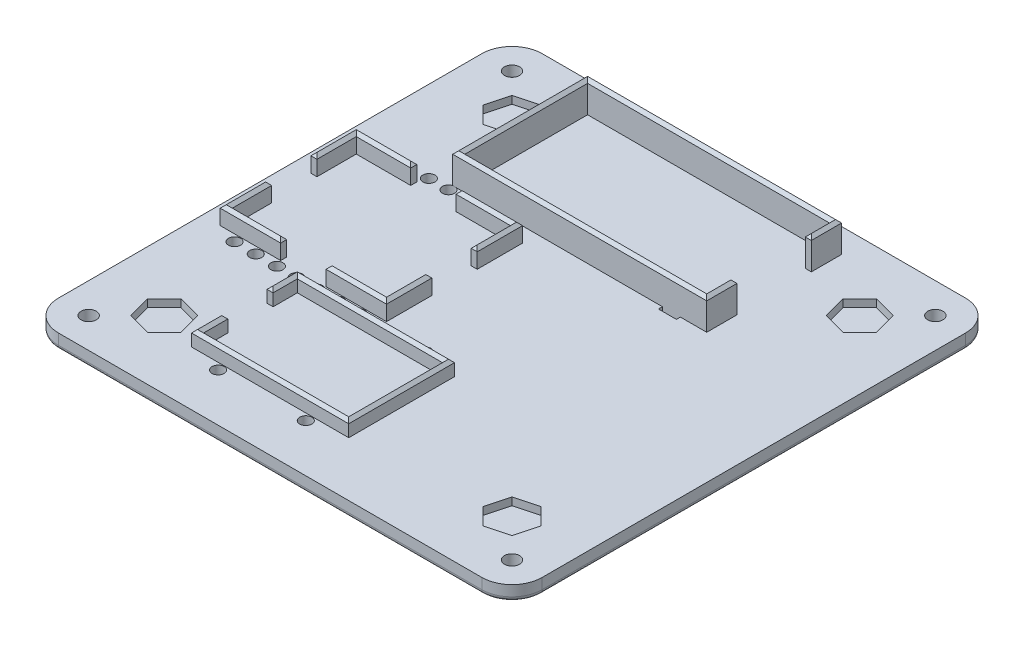
from build123d import *

# Parameters (mm, degrees)
SKETCH1_W           = 203.2
SKETCH1_H           = 203.2
BOSS_EXTRUDE1_DEPTH = 6.35
FILLET1_R           = 12.7
SKETCH2_R           = 3.175
CUT_EXTRUDE1_DEPTH  = 288.438345563
CUT_EXTRUDE2_DEPTH  = 3.175
BOSS_EXTRUDE2_DEPTH = 7.62
CHAMFER1_SIZE       = 1.27
BOSS_EXTRUDE3_DEPTH = 6.35
CHAMFER2_SIZE       = 1.27
SKETCH25_R          = 2.54
CUT_EXTRUDE3_DEPTH  = 6.35
BOSS_EXTRUDE4_DEPTH = 12.7
CHAMFER3_SIZE       = 1.27
SKETCH27_W          = 7.546250953
SKETCH27_H          = 2.549143633
SKETCH27_W_2        = 7.463160497
SKETCH27_H_2        = 1.676732019
CUT_EXTRUDE4_DEPTH  = 12.7
FILLET2_R           = 1.905


# Some blends are built 0.0001 mm under size
with BuildPart() as part:
    # Sketch1 → Boss-Extrude1 (new body)
    with BuildSketch(Plane(origin=(0, 0, 0), x_dir=(1, 0, 0), z_dir=(0, 1, 0))):
        with Locations((101.6, 101.6)):
            Rectangle(SKETCH1_W, SKETCH1_H)
    extrude(amount=BOSS_EXTRUDE1_DEPTH)

    # Fillet1
    fillet1_edges = [part.edges().sort_by_distance(p)[0] for p in [
        (0, 3.175, -203.2),
        (203.2, 3.175, -203.2),
        (203.2, 3.175, 0),
        (0, 3.175, 0),
    ]]
    fillet(fillet1_edges, radius=FILLET1_R)

    # Sketch2 → Cut-Extrude1 (cut, through all)
    with BuildSketch(Plane.XZ):
        with Locations(Location((12.7, -12.7, 0), (0, 0, 270))):
            Circle(SKETCH2_R)
        with Locations(Location((190.5, -12.7, 0), (0, 0, 270))):
            Circle(SKETCH2_R)
        with Locations(Location((190.5, -190.5, 0), (0, 0, 270))):
            Circle(SKETCH2_R)
        with Locations(Location((12.7, -190.5, 0), (0, 0, 270))):
            Circle(SKETCH2_R)
    extrude(amount=-CUT_EXTRUDE1_DEPTH, mode=Mode.SUBTRACT)

    # Sketch22 → Cut-Extrude2 (cut)
    with BuildSketch(Plane(origin=(0, 6.35, 0), x_dir=(1, 0, 0), z_dir=(0, 1, 0))):
        Polygon((181.654219065, 181.654219065), (172.052127253, 184.227091812), (165.022908188, 177.197872747), (167.595780935, 167.595780935), (177.197872747, 165.022908188), (184.227091812, 172.052127253), align=None)
        Polygon((18.972908188, 172.052127253), (21.545780935, 181.654219065), (31.147872747, 184.227091812), (38.177091812, 177.197872747), (35.604219065, 167.595780935), (26.002127253, 165.022908188), align=None)
        Polygon((184.227091812, 31.147872747), (181.654219065, 21.545780935), (172.052127253, 18.972908188), (165.022908188, 26.002127253), (167.595780935, 35.604219065), (177.197872747, 38.177091812), align=None)
        Polygon((21.545780935, 21.545780935), (31.147872747, 18.972908188), (38.177091812, 26.002127253), (35.604219065, 35.604219065), (26.002127253, 38.177091812), (18.972908188, 31.147872747), align=None)
    extrude(amount=-CUT_EXTRUDE2_DEPTH, mode=Mode.SUBTRACT)

    # Sketch23 → Boss-Extrude2 (add)
    with BuildSketch(Plane(origin=(0, 6.35, 0), x_dir=(1, 0, 0), z_dir=(0, 1, 0))):
        Polygon((77.47, 130.175), (52.07, 130.175), (52.07, 127.635), (74.93, 127.635), (74.93, 111.125), (77.47, 111.125), align=None)
        Polygon((77.47, 73.025), (52.07, 73.025), (52.07, 75.565), (74.93, 75.565), (74.93, 92.075), (77.47, 92.075), align=None)
        Polygon((7.62, 130.175), (7.62, 111.125), (10.16, 111.125), (10.16, 127.635), (33.02, 127.635), (33.02, 130.175), align=None)
        Polygon((10.16, 92.075), (7.62, 92.075), (7.62, 73.025), (33.02, 73.025), (33.02, 75.565), (10.16, 75.565), align=None)
    extrude(amount=BOSS_EXTRUDE2_DEPTH)

    # Chamfer1
    chamfer1_edges = [part.edges().sort_by_distance(p)[0] for p in [
        (77.47, 13.97, -120.65),
        (64.77, 13.97, -130.175),
        (52.07, 13.97, -128.905),
        (63.5, 13.97, -127.635),
        (74.93, 13.97, -119.38),
        (76.2, 13.97, -111.125),
        (7.62, 13.97, -82.55),
        (20.32, 13.97, -73.025),
        (33.02, 13.97, -74.295),
        (21.59, 13.97, -75.565),
        (10.16, 13.97, -83.82),
        (8.89, 13.97, -92.075),
        (77.47, 13.97, -82.55),
        (76.2, 13.97, -92.075),
        (74.93, 13.97, -83.82),
        (63.5, 13.97, -75.565),
        (52.07, 13.97, -74.295),
        (64.77, 13.97, -73.025),
        (20.32, 13.97, -130.175),
        (7.62, 13.97, -120.65),
        (8.89, 13.97, -111.125),
        (10.16, 13.97, -119.38),
        (21.59, 13.97, -127.635),
        (33.02, 13.97, -128.905),
    ]]
    chamfer(chamfer1_edges, length=CHAMFER1_SIZE - 0.0001)  # a hair under: the kernel refuses the full size

    # Sketch24 → Boss-Extrude3 (add)
    with BuildSketch(Plane(origin=(0, 6.35, 0), x_dir=(1, 0, 0), z_dir=(0, 1, 0))):
        Polygon((109.22, 64.77), (48.26, 64.77), (48.26, 54.61), (45.72, 54.61), (45.72, 67.31), (111.76, 67.31), (111.76, 22.86), (45.72, 22.86), (45.72, 35.56), (48.26, 35.56), (48.26, 25.4), (109.22, 25.4), align=None)
    extrude(amount=BOSS_EXTRUDE3_DEPTH)

    # Chamfer2
    chamfer2_edges = [part.edges().sort_by_distance(p)[0] for p in [
        (109.22, 12.7, -45.085),
        (78.74, 12.7, -25.4),
        (48.26, 12.7, -30.48),
        (46.99, 12.7, -35.56),
        (45.72, 12.7, -29.21),
        (78.74, 12.7, -22.86),
        (111.76, 12.7, -45.085),
        (78.74, 12.7, -67.31),
        (45.72, 12.7, -60.96),
        (46.99, 12.7, -54.61),
        (48.26, 12.7, -59.69),
        (78.74, 12.7, -64.77),
    ]]
    chamfer(chamfer2_edges, length=CHAMFER2_SIZE - 0.0001)  # a hair under: the kernel refuses the full size

    # Sketch25 → Cut-Extrude3 (cut)
    with BuildSketch(Plane(origin=(0, 6.35, 0), x_dir=(1, 0, 0), z_dir=(0, 1, 0))):
        with Locations(Location((68.58, 70.1675, 0), (0, 0, 270))):
            Circle(SKETCH25_R)
        with Locations(Location((59.69, 70.1675, 0), (0, 0, 270))):
            Circle(SKETCH25_R)
        with Locations(Location((50.8, 70.1675, 0), (0, 0, 270))):
            Circle(SKETCH25_R)
        with Locations(Location((42.545, 70.1675, 0), (0, 0, 270))):
            Circle(SKETCH25_R)
        with Locations(Location((34.29, 70.1675, 0), (0, 0, 270))):
            Circle(SKETCH25_R)
        with Locations(Location((25.4, 70.1675, 0), (0, 0, 270))):
            Circle(SKETCH25_R)
        with Locations(Location((16.51, 70.1675, 0), (0, 0, 270))):
            Circle(SKETCH25_R)
        with Locations(Location((16.51, 133.985, 0), (0, 0, 270))):
            Circle(SKETCH25_R)
        with Locations(Location((25.4, 133.985, 0), (0, 0, 270))):
            Circle(SKETCH25_R)
        with Locations(Location((34.29, 133.985, 0), (0, 0, 270))):
            Circle(SKETCH25_R)
        with Locations(Location((42.545, 133.985, 0), (0, 0, 270))):
            Circle(SKETCH25_R)
        with Locations(Location((50.8, 133.985, 0), (0, 0, 270))):
            Circle(SKETCH25_R)
        with Locations(Location((59.69, 133.985, 0), (0, 0, 270))):
            Circle(SKETCH25_R)
        with Locations(Location((68.58, 133.985, 0), (0, 0, 270))):
            Circle(SKETCH25_R)
        with Locations(Location((96.52, 70.104, 0), (0, 0, 270))):
            Circle(SKETCH25_R)
        with Locations(Location((96.52, 20.066, 0), (0, 0, 270))):
            Circle(SKETCH25_R)
        with Locations(Location((59.69, 20.066, 0), (0, 0, 270))):
            Circle(SKETCH25_R)
    extrude(amount=-CUT_EXTRUDE3_DEPTH, mode=Mode.SUBTRACT)

    # Sketch26 → Boss-Extrude4 (add)
    with BuildSketch(Plane(origin=(0, 6.35, 0), x_dir=(1, 0, 0), z_dir=(0, 1, 0))):
        Polygon((146.05, 190.5), (44.45, 190.5), (44.45, 138.938), (146.05, 138.938), (146.05, 149.098), (148.59, 149.098), (148.59, 136.398), (41.91, 136.398), (41.91, 193.04), (148.59, 193.04), (148.59, 180.34), (146.05, 180.34), align=None)
    extrude(amount=BOSS_EXTRUDE4_DEPTH)

    # Chamfer3
    chamfer3_edges = [part.edges().sort_by_distance(p)[0] for p in [
        (146.05, 19.05, -185.42),
        (147.32, 19.05, -180.34),
        (148.59, 19.05, -186.69),
        (95.25, 19.05, -193.04),
        (41.91, 19.05, -164.719),
        (95.25, 19.05, -136.398),
        (148.59, 19.05, -142.748),
        (147.32, 19.05, -149.098),
        (146.05, 19.05, -144.018),
        (95.25, 19.05, -138.938),
        (44.45, 19.05, -164.719),
        (95.25, 19.05, -190.5),
    ]]
    chamfer(chamfer3_edges, length=CHAMFER3_SIZE - 0.0001)  # a hair under: the kernel refuses the full size

    # Sketch27 → Cut-Extrude4 (cut)
    with BuildSketch(Plane(origin=(0, 6.35, 0), x_dir=(1, 0, 0), z_dir=(0, 1, 0))):
        with Locations((133.737937456, 194.314571817)):
            Rectangle(SKETCH27_W, SKETCH27_H)
        with Locations((57.743012128, 194.314571817)):
            Rectangle(SKETCH27_W_2, SKETCH27_H)
        with Locations((133.737937456, 135.559633991)):
            Rectangle(SKETCH27_W, SKETCH27_H_2)
    extrude(amount=-CUT_EXTRUDE4_DEPTH, mode=Mode.SUBTRACT)

    # Fillet2
    # the kernel refuses this fillet: 1.905 mm, written as the material it takes off along each edge
    with BuildSketch(Plane(origin=(0, 0, -190.5), x_dir=(0, 1, 0), z_dir=(0, 0, 1)), Plane(origin=(190.5, 0, -203.2), x_dir=(0, 1, 0), z_dir=(-1, 0, 0)), Plane(origin=(203.2, 0, -12.7), x_dir=(0, 1, 0), z_dir=(0, 0, -1)), Plane(origin=(12.7, 0, 0), x_dir=(0, 1, 0), z_dir=(1, 0, 0))) as fillet2_piece_1:
        with BuildLine():
            CenterArc((FILLET2_R, -FILLET2_R), FILLET2_R, 90, 90)
            Line((0, -FILLET2_R), (0, 0))
            Line((0, 0), (FILLET2_R, 0))
        make_face()
    fillet2_piece_1_solid = extrude(amount=177.8, mode=Mode.PRIVATE)
    with BuildSketch(Plane(origin=(190.5, 0, -190.5), x_dir=(1, 0, 0), z_dir=(0, 0, 1))) as fillet2_piece_2:
        with BuildLine():
            CenterArc((12.7 - FILLET2_R, FILLET2_R), FILLET2_R, 270, 90)
            Line((12.7 - FILLET2_R, 0), (12.7, 0))
            Line((12.7, 0), (12.7, FILLET2_R))
        make_face()
    fillet2_piece_2_solid = revolve(axis=Axis((190.5, 0, -190.5), (0, 1, 0)), revolution_arc=90, mode=Mode.PRIVATE)
    with BuildSketch(Plane(origin=(190.5, 0, -12.7), x_dir=(0, 0, 1), z_dir=(-1, 0, 0))) as fillet2_piece_3:
        with BuildLine():
            CenterArc((12.7 - FILLET2_R, FILLET2_R), FILLET2_R, 270, 90)
            Line((12.7 - FILLET2_R, 0), (12.7, 0))
            Line((12.7, 0), (12.7, FILLET2_R))
        make_face()
    fillet2_piece_3_solid = revolve(axis=Axis((190.5, 0, -12.7), (0, 1, 0)), revolution_arc=90, mode=Mode.PRIVATE)
    with BuildSketch(Plane(origin=(12.7, 0, -12.7), x_dir=(0, 0, 1), z_dir=(1, 0, 0))) as fillet2_piece_4:
        with BuildLine():
            CenterArc((12.7 - FILLET2_R, -FILLET2_R), FILLET2_R, 0, 90)
            Line((12.7 - FILLET2_R, 0), (12.7, 0))
            Line((12.7, 0), (12.7, -FILLET2_R))
        make_face()
    fillet2_piece_4_solid = revolve(axis=Axis((12.7, 0, -12.7), (0, -1, 0)), revolution_arc=90, mode=Mode.PRIVATE)
    with BuildSketch(Plane(origin=(12.7, 0, -190.5), x_dir=(0, 0, -1), z_dir=(1, 0, 0))) as fillet2_piece_5:
        with BuildLine():
            CenterArc((12.7 - FILLET2_R, FILLET2_R), FILLET2_R, 270, 90)
            Line((12.7 - FILLET2_R, 0), (12.7, 0))
            Line((12.7, 0), (12.7, FILLET2_R))
        make_face()
    fillet2_piece_5_solid = revolve(axis=Axis((12.7, 0, -190.5), (0, 1, 0)), revolution_arc=90, mode=Mode.PRIVATE)
    with BuildSketch(Plane(origin=(59.69, 0, -70.1675), x_dir=(0, 0, 1), z_dir=(-1, 0, 0))) as fillet2_piece_6:
        with BuildLine():
            CenterArc((2.54 + FILLET2_R, FILLET2_R), FILLET2_R, 180, 90)
            Line((2.54 + FILLET2_R, 0), (2.54, 0))
            Line((2.54, 0), (2.54, FILLET2_R))
        make_face()
    fillet2_piece_6_solid = revolve(axis=Axis((59.69, 0, -70.1675), (0, 1, 0)), mode=Mode.PRIVATE)
    with BuildSketch(Plane(origin=(50.8, 0, -70.1675), x_dir=(0, 0, 1), z_dir=(-1, 0, 0))) as fillet2_piece_7:
        with BuildLine():
            CenterArc((2.54 + FILLET2_R, FILLET2_R), FILLET2_R, 180, 90)
            Line((2.54 + FILLET2_R, 0), (2.54, 0))
            Line((2.54, 0), (2.54, FILLET2_R))
        make_face()
    fillet2_piece_7_solid = revolve(axis=Axis((50.8, 0, -70.1675), (0, 1, 0)), mode=Mode.PRIVATE)
    with BuildSketch(Plane(origin=(42.545, 0, -70.1675), x_dir=(0, 0, 1), z_dir=(-1, 0, 0))) as fillet2_piece_8:
        with BuildLine():
            CenterArc((2.54 + FILLET2_R, FILLET2_R), FILLET2_R, 180, 90)
            Line((2.54 + FILLET2_R, 0), (2.54, 0))
            Line((2.54, 0), (2.54, FILLET2_R))
        make_face()
    fillet2_piece_8_solid = revolve(axis=Axis((42.545, 0, -70.1675), (0, 1, 0)), mode=Mode.PRIVATE)
    with BuildSketch(Plane(origin=(34.29, 0, -70.1675), x_dir=(0, 0, 1), z_dir=(-1, 0, 0))) as fillet2_piece_9:
        with BuildLine():
            CenterArc((2.54 + FILLET2_R, FILLET2_R), FILLET2_R, 180, 90)
            Line((2.54 + FILLET2_R, 0), (2.54, 0))
            Line((2.54, 0), (2.54, FILLET2_R))
        make_face()
    fillet2_piece_9_solid = revolve(axis=Axis((34.29, 0, -70.1675), (0, 1, 0)), mode=Mode.PRIVATE)
    with BuildSketch(Plane(origin=(25.4, 0, -70.1675), x_dir=(0, 0, 1), z_dir=(-1, 0, 0))) as fillet2_piece_10:
        with BuildLine():
            CenterArc((2.54 + FILLET2_R, FILLET2_R), FILLET2_R, 180, 90)
            Line((2.54 + FILLET2_R, 0), (2.54, 0))
            Line((2.54, 0), (2.54, FILLET2_R))
        make_face()
    fillet2_piece_10_solid = revolve(axis=Axis((25.4, 0, -70.1675), (0, 1, 0)), mode=Mode.PRIVATE)
    with BuildSketch(Plane(origin=(16.51, 0, -70.1675), x_dir=(0, 0, 1), z_dir=(-1, 0, 0))) as fillet2_piece_11:
        with BuildLine():
            CenterArc((2.54 + FILLET2_R, FILLET2_R), FILLET2_R, 180, 90)
            Line((2.54 + FILLET2_R, 0), (2.54, 0))
            Line((2.54, 0), (2.54, FILLET2_R))
        make_face()
    fillet2_piece_11_solid = revolve(axis=Axis((16.51, 0, -70.1675), (0, 1, 0)), mode=Mode.PRIVATE)
    with BuildSketch(Plane(origin=(16.51, 0, -133.985), x_dir=(0, 0, 1), z_dir=(-1, 0, 0))) as fillet2_piece_12:
        with BuildLine():
            CenterArc((2.54 + FILLET2_R, FILLET2_R), FILLET2_R, 180, 90)
            Line((2.54 + FILLET2_R, 0), (2.54, 0))
            Line((2.54, 0), (2.54, FILLET2_R))
        make_face()
    fillet2_piece_12_solid = revolve(axis=Axis((16.51, 0, -133.985), (0, 1, 0)), mode=Mode.PRIVATE)
    with BuildSketch(Plane(origin=(25.4, 0, -133.985), x_dir=(0, 0, 1), z_dir=(-1, 0, 0))) as fillet2_piece_13:
        with BuildLine():
            CenterArc((2.54 + FILLET2_R, FILLET2_R), FILLET2_R, 180, 90)
            Line((2.54 + FILLET2_R, 0), (2.54, 0))
            Line((2.54, 0), (2.54, FILLET2_R))
        make_face()
    fillet2_piece_13_solid = revolve(axis=Axis((25.4, 0, -133.985), (0, 1, 0)), mode=Mode.PRIVATE)
    with BuildSketch(Plane(origin=(68.58, 0, -133.985), x_dir=(0, 0, 1), z_dir=(-1, 0, 0))) as fillet2_piece_14:
        with BuildLine():
            CenterArc((2.54 + FILLET2_R, FILLET2_R), FILLET2_R, 180, 90)
            Line((2.54 + FILLET2_R, 0), (2.54, 0))
            Line((2.54, 0), (2.54, FILLET2_R))
        make_face()
    fillet2_piece_14_solid = revolve(axis=Axis((68.58, 0, -133.985), (0, 1, 0)), mode=Mode.PRIVATE)
    with BuildSketch(Plane(origin=(96.52, 0, -20.066), x_dir=(0, 0, 1), z_dir=(-1, 0, 0))) as fillet2_piece_15:
        with BuildLine():
            CenterArc((2.54 + FILLET2_R, FILLET2_R), FILLET2_R, 180, 90)
            Line((2.54 + FILLET2_R, 0), (2.54, 0))
            Line((2.54, 0), (2.54, FILLET2_R))
        make_face()
    fillet2_piece_15_solid = revolve(axis=Axis((96.52, 0, -20.066), (0, 1, 0)), mode=Mode.PRIVATE)
    with BuildSketch(Plane(origin=(59.69, 0, -20.066), x_dir=(0, 0, 1), z_dir=(-1, 0, 0))) as fillet2_piece_16:
        with BuildLine():
            CenterArc((2.54 + FILLET2_R, FILLET2_R), FILLET2_R, 180, 90)
            Line((2.54 + FILLET2_R, 0), (2.54, 0))
            Line((2.54, 0), (2.54, FILLET2_R))
        make_face()
    fillet2_piece_16_solid = revolve(axis=Axis((59.69, 0, -20.066), (0, 1, 0)), mode=Mode.PRIVATE)
    with BuildSketch(Plane(origin=(96.52, 0, -70.104), x_dir=(0, 0, 1), z_dir=(-1, 0, 0))) as fillet2_piece_17:
        with BuildLine():
            CenterArc((2.54 + FILLET2_R, FILLET2_R), FILLET2_R, 180, 90)
            Line((2.54 + FILLET2_R, 0), (2.54, 0))
            Line((2.54, 0), (2.54, FILLET2_R))
        make_face()
    fillet2_piece_17_solid = revolve(axis=Axis((96.52, 0, -70.104), (0, 1, 0)), mode=Mode.PRIVATE)
    with BuildSketch(Plane(origin=(59.69, 0, -133.985), x_dir=(0, 0, 1), z_dir=(-1, 0, 0))) as fillet2_piece_18:
        with BuildLine():
            CenterArc((2.54 + FILLET2_R, FILLET2_R), FILLET2_R, 180, 90)
            Line((2.54 + FILLET2_R, 0), (2.54, 0))
            Line((2.54, 0), (2.54, FILLET2_R))
        make_face()
    fillet2_piece_18_solid = revolve(axis=Axis((59.69, 0, -133.985), (0, 1, 0)), mode=Mode.PRIVATE)
    with BuildSketch(Plane(origin=(50.8, 0, -133.985), x_dir=(0, 0, 1), z_dir=(-1, 0, 0))) as fillet2_piece_19:
        with BuildLine():
            CenterArc((2.54 + FILLET2_R, FILLET2_R), FILLET2_R, 180, 90)
            Line((2.54 + FILLET2_R, 0), (2.54, 0))
            Line((2.54, 0), (2.54, FILLET2_R))
        make_face()
    fillet2_piece_19_solid = revolve(axis=Axis((50.8, 0, -133.985), (0, 1, 0)), mode=Mode.PRIVATE)
    with BuildSketch(Plane(origin=(42.545, 0, -133.985), x_dir=(0, 0, 1), z_dir=(-1, 0, 0))) as fillet2_piece_20:
        with BuildLine():
            CenterArc((2.54 + FILLET2_R, FILLET2_R), FILLET2_R, 180, 90)
            Line((2.54 + FILLET2_R, 0), (2.54, 0))
            Line((2.54, 0), (2.54, FILLET2_R))
        make_face()
    fillet2_piece_20_solid = revolve(axis=Axis((42.545, 0, -133.985), (0, 1, 0)), mode=Mode.PRIVATE)
    with BuildSketch(Plane(origin=(34.29, 0, -133.985), x_dir=(0, 0, 1), z_dir=(-1, 0, 0))) as fillet2_piece_21:
        with BuildLine():
            CenterArc((2.54 + FILLET2_R, FILLET2_R), FILLET2_R, 180, 90)
            Line((2.54 + FILLET2_R, 0), (2.54, 0))
            Line((2.54, 0), (2.54, FILLET2_R))
        make_face()
    fillet2_piece_21_solid = revolve(axis=Axis((34.29, 0, -133.985), (0, 1, 0)), mode=Mode.PRIVATE)
    with BuildSketch(Plane(origin=(68.58, 0, -70.1675), x_dir=(0, 0, 1), z_dir=(-1, 0, 0))) as fillet2_piece_22:
        with BuildLine():
            CenterArc((2.54 + FILLET2_R, FILLET2_R), FILLET2_R, 180, 90)
            Line((2.54 + FILLET2_R, 0), (2.54, 0))
            Line((2.54, 0), (2.54, FILLET2_R))
        make_face()
    fillet2_piece_22_solid = revolve(axis=Axis((68.58, 0, -70.1675), (0, 1, 0)), mode=Mode.PRIVATE)
    with BuildSketch(Plane(origin=(12.7, 0, -190.5), x_dir=(0, 0, -1), z_dir=(-1, 0, 0))) as fillet2_piece_23:
        with BuildLine():
            CenterArc((3.175 + FILLET2_R, -FILLET2_R), FILLET2_R, 90, 90)
            Line((3.175 + FILLET2_R, 0), (3.175, 0))
            Line((3.175, 0), (3.175, -FILLET2_R))
        make_face()
    fillet2_piece_23_solid = revolve(axis=Axis((12.7, 0, -190.5), (0, -1, 0)), mode=Mode.PRIVATE)
    with BuildSketch(Plane(origin=(190.5, 0, -190.5), x_dir=(0, 0, -1), z_dir=(-1, 0, 0))) as fillet2_piece_24:
        with BuildLine():
            CenterArc((3.175 + FILLET2_R, -FILLET2_R), FILLET2_R, 90, 90)
            Line((3.175 + FILLET2_R, 0), (3.175, 0))
            Line((3.175, 0), (3.175, -FILLET2_R))
        make_face()
    fillet2_piece_24_solid = revolve(axis=Axis((190.5, 0, -190.5), (0, -1, 0)), mode=Mode.PRIVATE)
    with BuildSketch(Plane(origin=(190.5, 0, -12.7), x_dir=(0, 0, -1), z_dir=(-1, 0, 0))) as fillet2_piece_25:
        with BuildLine():
            CenterArc((3.175 + FILLET2_R, -FILLET2_R), FILLET2_R, 90, 90)
            Line((3.175 + FILLET2_R, 0), (3.175, 0))
            Line((3.175, 0), (3.175, -FILLET2_R))
        make_face()
    fillet2_piece_25_solid = revolve(axis=Axis((190.5, 0, -12.7), (0, -1, 0)), mode=Mode.PRIVATE)
    with BuildSketch(Plane(origin=(129.964811979, 0, -195.589143633), x_dir=(0, 1, 0), z_dir=(1, 0, 0)), Plane(origin=(137.511062932, 0, -193.04), x_dir=(0, 1, 0), z_dir=(-1, 0, 0))) as fillet2_piece_26:
        with BuildLine():
            CenterArc((FILLET2_R, -FILLET2_R), FILLET2_R, 90, 90)
            Line((0, -FILLET2_R), (0, 0))
            Line((0, 0), (FILLET2_R, 0))
        make_face()
    fillet2_piece_26_solid = extrude(amount=7.546250952, mode=Mode.PRIVATE)
    with BuildSketch(Plane(origin=(129.964811979, 0, -193.04), x_dir=(0, 1, 0), z_dir=(0, 0, -1)), Plane(origin=(137.511062932, 0, -195.589143633), x_dir=(0, 1, 0), z_dir=(0, 0, 1)), Plane(origin=(54.01143188, 0, -193.04), x_dir=(0, 1, 0), z_dir=(0, 0, -1)), Plane(origin=(61.474592377, 0, -195.589143633), x_dir=(0, 1, 0), z_dir=(0, 0, 1))) as fillet2_piece_27:
        with BuildLine():
            CenterArc((FILLET2_R, -FILLET2_R), FILLET2_R, 90, 90)
            Line((0, -FILLET2_R), (0, 0))
            Line((0, 0), (FILLET2_R, 0))
        make_face()
    fillet2_piece_27_solid = extrude(amount=2.549143633, mode=Mode.PRIVATE)
    with BuildSketch(Plane(origin=(54.01143188, 0, -195.589143633), x_dir=(0, 1, 0), z_dir=(1, 0, 0)), Plane(origin=(61.474592377, 0, -193.04), x_dir=(0, 1, 0), z_dir=(-1, 0, 0))) as fillet2_piece_28:
        with BuildLine():
            CenterArc((FILLET2_R, -FILLET2_R), FILLET2_R, 90, 90)
            Line((0, -FILLET2_R), (0, 0))
            Line((0, 0), (FILLET2_R, 0))
        make_face()
    fillet2_piece_28_solid = extrude(amount=7.463160498, mode=Mode.PRIVATE)
    with BuildSketch(Plane(origin=(137.511062932, 0, -136.398), x_dir=(0, 1, 0), z_dir=(-1, 0, 0)), Plane(origin=(129.964811979, 0, -134.721267981), x_dir=(0, 1, 0), z_dir=(1, 0, 0))) as fillet2_piece_29:
        with BuildLine():
            CenterArc((FILLET2_R, FILLET2_R), FILLET2_R, 180, 90)
            Line((0, FILLET2_R), (0, 0))
            Line((0, 0), (FILLET2_R, 0))
        make_face()
    fillet2_piece_29_solid = extrude(amount=7.546250952, mode=Mode.PRIVATE)
    with BuildSketch(Plane(origin=(129.964811979, 0, -136.398), x_dir=(0, 1, 0), z_dir=(0, 0, 1)), Plane(origin=(137.511062932, 0, -134.721267981), x_dir=(0, 1, 0), z_dir=(0, 0, -1))) as fillet2_piece_30:
        with BuildLine():
            CenterArc((FILLET2_R, FILLET2_R), FILLET2_R, 180, 90)
            Line((0, FILLET2_R), (0, 0))
            Line((0, 0), (FILLET2_R, 0))
        make_face()
    fillet2_piece_30_solid = extrude(amount=1.676732019, mode=Mode.PRIVATE)
    with BuildSketch(Plane(origin=(12.7, 0, -12.7), x_dir=(0, 0, -1), z_dir=(-1, 0, 0))) as fillet2_piece_31:
        with BuildLine():
            CenterArc((3.175 + FILLET2_R, -FILLET2_R), FILLET2_R, 90, 90)
            Line((3.175 + FILLET2_R, 0), (3.175, 0))
            Line((3.175, 0), (3.175, -FILLET2_R))
        make_face()
    fillet2_piece_31_solid = revolve(axis=Axis((12.7, 0, -12.7), (0, -1, 0)), mode=Mode.PRIVATE)
    with BuildSketch(Plane(origin=(125.202311979, 0, -195.589143633), x_dir=(0, 1, 0), z_dir=(1, 0, 0))) as fillet2_piece_32a_section:
        with BuildLine():
            CenterArc((FILLET2_R, -FILLET2_R), FILLET2_R, 90, 90)
            Line((0, -FILLET2_R), (0, 0))
            Line((0, 0), (FILLET2_R, 0))
        make_face()
    fillet2_piece_32a = extrude(amount=12.308750952, mode=Mode.PRIVATE)
    fillet2_piece_32a = split(fillet2_piece_32a, bisect_by=Plane(origin=(129.964811979, 0.431282693, -196.020426326), z_dir=(-1, 0, 0)), keep=Keep.TOP, mode=Mode.PRIVATE)
    with BuildSketch(Plane(origin=(129.964811979, 0, -193.04), x_dir=(0, 1, 0), z_dir=(0, 0, -1))) as fillet2_piece_32b_section:
        with BuildLine():
            CenterArc((FILLET2_R, -FILLET2_R), FILLET2_R, 90, 90)
            Line((0, -FILLET2_R), (0, 0))
            Line((0, 0), (FILLET2_R, 0))
        make_face()
    fillet2_piece_32b = extrude(amount=7.311643633, mode=Mode.PRIVATE)
    fillet2_piece_32b = split(fillet2_piece_32b, bisect_by=Plane(origin=(129.533529287, 0.431282693, -195.589143633), z_dir=(0, 0, -1)), keep=Keep.TOP, mode=Mode.PRIVATE)
    fillet2_piece_32 = fillet2_piece_32a & fillet2_piece_32b
    with BuildSketch(Plane(origin=(137.511062932, 0, -200.351643633), x_dir=(0, 1, 0), z_dir=(0, 0, 1))) as fillet2_piece_33a_section:
        with BuildLine():
            CenterArc((FILLET2_R, -FILLET2_R), FILLET2_R, 90, 90)
            Line((0, -FILLET2_R), (0, 0))
            Line((0, 0), (FILLET2_R, 0))
        make_face()
    fillet2_piece_33a = extrude(amount=7.311643633, mode=Mode.PRIVATE)
    fillet2_piece_33a = split(fillet2_piece_33a, bisect_by=Plane(origin=(137.942345624, 0.431282693, -195.589143633), z_dir=(0, 0, -1)), keep=Keep.TOP, mode=Mode.PRIVATE)
    with BuildSketch(Plane(origin=(129.964811979, 0, -195.589143633), x_dir=(0, 1, 0), z_dir=(1, 0, 0))) as fillet2_piece_33b_section:
        with BuildLine():
            CenterArc((FILLET2_R, -FILLET2_R), FILLET2_R, 90, 90)
            Line((0, -FILLET2_R), (0, 0))
            Line((0, 0), (FILLET2_R, 0))
        make_face()
    fillet2_piece_33b = extrude(amount=12.308750952, mode=Mode.PRIVATE)
    fillet2_piece_33b = split(fillet2_piece_33b, bisect_by=Plane(origin=(137.511062932, 0.431282693, -196.020426326), z_dir=(1, 0, 0)), keep=Keep.TOP, mode=Mode.PRIVATE)
    fillet2_piece_33 = fillet2_piece_33a & fillet2_piece_33b
    with BuildSketch(Plane(origin=(137.511062932, 0, -193.04), x_dir=(0, 1, 0), z_dir=(-1, 0, 0))) as fillet2_piece_34a_section:
        with BuildLine():
            CenterArc((FILLET2_R, -FILLET2_R), FILLET2_R, 90, 90)
            Line((0, -FILLET2_R), (0, 0))
            Line((0, 0), (FILLET2_R, 0))
        make_face()
    fillet2_piece_34a = extrude(amount=12.308750952, mode=Mode.PRIVATE)
    fillet2_piece_34a = split(fillet2_piece_34a, bisect_by=Plane(origin=(129.964811979, 0.431282693, -192.608717307), z_dir=(-1, 0, 0)), keep=Keep.TOP, mode=Mode.PRIVATE)
    with BuildSketch(Plane(origin=(129.964811979, 0, -188.2775), x_dir=(0, 1, 0), z_dir=(0, 0, -1))) as fillet2_piece_34b_section:
        with BuildLine():
            CenterArc((FILLET2_R, -FILLET2_R), FILLET2_R, 90, 90)
            Line((0, -FILLET2_R), (0, 0))
            Line((0, 0), (FILLET2_R, 0))
        make_face()
    fillet2_piece_34b = extrude(amount=7.311643633, mode=Mode.PRIVATE)
    fillet2_piece_34b = split(fillet2_piece_34b, bisect_by=Plane(origin=(129.533529287, 0.431282693, -193.04), z_dir=(0, 0, 1)), keep=Keep.TOP, mode=Mode.PRIVATE)
    fillet2_piece_34 = fillet2_piece_34a & fillet2_piece_34b
    with BuildSketch(Plane(origin=(142.273562932, 0, -193.04), x_dir=(0, 1, 0), z_dir=(-1, 0, 0))) as fillet2_piece_35a_section:
        with BuildLine():
            CenterArc((FILLET2_R, -FILLET2_R), FILLET2_R, 90, 90)
            Line((0, -FILLET2_R), (0, 0))
            Line((0, 0), (FILLET2_R, 0))
        make_face()
    fillet2_piece_35a = extrude(amount=12.308750952, mode=Mode.PRIVATE)
    fillet2_piece_35a = split(fillet2_piece_35a, bisect_by=Plane(origin=(137.511062932, 0.431282693, -192.608717307), z_dir=(1, 0, 0)), keep=Keep.TOP, mode=Mode.PRIVATE)
    with BuildSketch(Plane(origin=(137.511062932, 0, -195.589143633), x_dir=(0, 1, 0), z_dir=(0, 0, 1))) as fillet2_piece_35b_section:
        with BuildLine():
            CenterArc((FILLET2_R, -FILLET2_R), FILLET2_R, 90, 90)
            Line((0, -FILLET2_R), (0, 0))
            Line((0, 0), (FILLET2_R, 0))
        make_face()
    fillet2_piece_35b = extrude(amount=7.311643633, mode=Mode.PRIVATE)
    fillet2_piece_35b = split(fillet2_piece_35b, bisect_by=Plane(origin=(137.942345624, 0.431282693, -193.04), z_dir=(0, 0, 1)), keep=Keep.TOP, mode=Mode.PRIVATE)
    fillet2_piece_35 = fillet2_piece_35a & fillet2_piece_35b
    with BuildSketch(Plane(origin=(49.24893188, 0, -195.589143633), x_dir=(0, 1, 0), z_dir=(1, 0, 0))) as fillet2_piece_36a_section:
        with BuildLine():
            CenterArc((FILLET2_R, -FILLET2_R), FILLET2_R, 90, 90)
            Line((0, -FILLET2_R), (0, 0))
            Line((0, 0), (FILLET2_R, 0))
        make_face()
    fillet2_piece_36a = extrude(amount=12.225660498, mode=Mode.PRIVATE)
    fillet2_piece_36a = split(fillet2_piece_36a, bisect_by=Plane(origin=(54.01143188, 0.431282693, -196.020426326), z_dir=(-1, 0, 0)), keep=Keep.TOP, mode=Mode.PRIVATE)
    with BuildSketch(Plane(origin=(54.01143188, 0, -193.04), x_dir=(0, 1, 0), z_dir=(0, 0, -1))) as fillet2_piece_36b_section:
        with BuildLine():
            CenterArc((FILLET2_R, -FILLET2_R), FILLET2_R, 90, 90)
            Line((0, -FILLET2_R), (0, 0))
            Line((0, 0), (FILLET2_R, 0))
        make_face()
    fillet2_piece_36b = extrude(amount=7.311643633, mode=Mode.PRIVATE)
    fillet2_piece_36b = split(fillet2_piece_36b, bisect_by=Plane(origin=(53.580149187, 0.431282693, -195.589143633), z_dir=(0, 0, -1)), keep=Keep.TOP, mode=Mode.PRIVATE)
    fillet2_piece_36 = fillet2_piece_36a & fillet2_piece_36b
    with BuildSketch(Plane(origin=(61.474592377, 0, -200.351643633), x_dir=(0, 1, 0), z_dir=(0, 0, 1))) as fillet2_piece_37a_section:
        with BuildLine():
            CenterArc((FILLET2_R, -FILLET2_R), FILLET2_R, 90, 90)
            Line((0, -FILLET2_R), (0, 0))
            Line((0, 0), (FILLET2_R, 0))
        make_face()
    fillet2_piece_37a = extrude(amount=7.311643633, mode=Mode.PRIVATE)
    fillet2_piece_37a = split(fillet2_piece_37a, bisect_by=Plane(origin=(61.90587507, 0.431282693, -195.589143633), z_dir=(0, 0, -1)), keep=Keep.TOP, mode=Mode.PRIVATE)
    with BuildSketch(Plane(origin=(54.01143188, 0, -195.589143633), x_dir=(0, 1, 0), z_dir=(1, 0, 0))) as fillet2_piece_37b_section:
        with BuildLine():
            CenterArc((FILLET2_R, -FILLET2_R), FILLET2_R, 90, 90)
            Line((0, -FILLET2_R), (0, 0))
            Line((0, 0), (FILLET2_R, 0))
        make_face()
    fillet2_piece_37b = extrude(amount=12.225660498, mode=Mode.PRIVATE)
    fillet2_piece_37b = split(fillet2_piece_37b, bisect_by=Plane(origin=(61.474592377, 0.431282693, -196.020426326), z_dir=(1, 0, 0)), keep=Keep.TOP, mode=Mode.PRIVATE)
    fillet2_piece_37 = fillet2_piece_37a & fillet2_piece_37b
    with BuildSketch(Plane(origin=(61.474592377, 0, -193.04), x_dir=(0, 1, 0), z_dir=(-1, 0, 0))) as fillet2_piece_38a_section:
        with BuildLine():
            CenterArc((FILLET2_R, -FILLET2_R), FILLET2_R, 90, 90)
            Line((0, -FILLET2_R), (0, 0))
            Line((0, 0), (FILLET2_R, 0))
        make_face()
    fillet2_piece_38a = extrude(amount=12.225660498, mode=Mode.PRIVATE)
    fillet2_piece_38a = split(fillet2_piece_38a, bisect_by=Plane(origin=(54.01143188, 0.431282693, -192.608717307), z_dir=(-1, 0, 0)), keep=Keep.TOP, mode=Mode.PRIVATE)
    with BuildSketch(Plane(origin=(54.01143188, 0, -188.2775), x_dir=(0, 1, 0), z_dir=(0, 0, -1))) as fillet2_piece_38b_section:
        with BuildLine():
            CenterArc((FILLET2_R, -FILLET2_R), FILLET2_R, 90, 90)
            Line((0, -FILLET2_R), (0, 0))
            Line((0, 0), (FILLET2_R, 0))
        make_face()
    fillet2_piece_38b = extrude(amount=7.311643633, mode=Mode.PRIVATE)
    fillet2_piece_38b = split(fillet2_piece_38b, bisect_by=Plane(origin=(53.580149187, 0.431282693, -193.04), z_dir=(0, 0, 1)), keep=Keep.TOP, mode=Mode.PRIVATE)
    fillet2_piece_38 = fillet2_piece_38a & fillet2_piece_38b
    with BuildSketch(Plane(origin=(66.237092377, 0, -193.04), x_dir=(0, 1, 0), z_dir=(-1, 0, 0))) as fillet2_piece_39a_section:
        with BuildLine():
            CenterArc((FILLET2_R, -FILLET2_R), FILLET2_R, 90, 90)
            Line((0, -FILLET2_R), (0, 0))
            Line((0, 0), (FILLET2_R, 0))
        make_face()
    fillet2_piece_39a = extrude(amount=12.225660498, mode=Mode.PRIVATE)
    fillet2_piece_39a = split(fillet2_piece_39a, bisect_by=Plane(origin=(61.474592377, 0.431282693, -192.608717307), z_dir=(1, 0, 0)), keep=Keep.TOP, mode=Mode.PRIVATE)
    with BuildSketch(Plane(origin=(61.474592377, 0, -195.589143633), x_dir=(0, 1, 0), z_dir=(0, 0, 1))) as fillet2_piece_39b_section:
        with BuildLine():
            CenterArc((FILLET2_R, -FILLET2_R), FILLET2_R, 90, 90)
            Line((0, -FILLET2_R), (0, 0))
            Line((0, 0), (FILLET2_R, 0))
        make_face()
    fillet2_piece_39b = extrude(amount=7.311643633, mode=Mode.PRIVATE)
    fillet2_piece_39b = split(fillet2_piece_39b, bisect_by=Plane(origin=(61.90587507, 0.431282693, -193.04), z_dir=(0, 0, 1)), keep=Keep.TOP, mode=Mode.PRIVATE)
    fillet2_piece_39 = fillet2_piece_39a & fillet2_piece_39b
    with BuildSketch(Plane(origin=(142.273562932, 0, -136.398), x_dir=(0, 1, 0), z_dir=(-1, 0, 0))) as fillet2_piece_40a_section:
        with BuildLine():
            CenterArc((FILLET2_R, FILLET2_R), FILLET2_R, 180, 90)
            Line((0, FILLET2_R), (0, 0))
            Line((0, 0), (FILLET2_R, 0))
        make_face()
    fillet2_piece_40a = extrude(amount=12.308750952, mode=Mode.PRIVATE)
    fillet2_piece_40a = split(fillet2_piece_40a, bisect_by=Plane(origin=(137.511062932, 0.431282693, -136.829282693), z_dir=(1, 0, 0)), keep=Keep.TOP, mode=Mode.PRIVATE)
    with BuildSketch(Plane(origin=(137.511062932, 0, -134.721267981), x_dir=(0, 1, 0), z_dir=(0, 0, -1))) as fillet2_piece_40b_section:
        with BuildLine():
            CenterArc((FILLET2_R, FILLET2_R), FILLET2_R, 180, 90)
            Line((0, FILLET2_R), (0, 0))
            Line((0, 0), (FILLET2_R, 0))
        make_face()
    fillet2_piece_40b = extrude(amount=6.439232019, mode=Mode.PRIVATE)
    fillet2_piece_40b = split(fillet2_piece_40b, bisect_by=Plane(origin=(137.942345624, 0.431282693, -136.398), z_dir=(0, 0, -1)), keep=Keep.TOP, mode=Mode.PRIVATE)
    fillet2_piece_40 = fillet2_piece_40a & fillet2_piece_40b
    with BuildSketch(Plane(origin=(137.511062932, 0, -136.398), x_dir=(0, 1, 0), z_dir=(-1, 0, 0))) as fillet2_piece_41a_section:
        with BuildLine():
            CenterArc((FILLET2_R, FILLET2_R), FILLET2_R, 180, 90)
            Line((0, FILLET2_R), (0, 0))
            Line((0, 0), (FILLET2_R, 0))
        make_face()
    fillet2_piece_41a = extrude(amount=12.308750952, mode=Mode.PRIVATE)
    fillet2_piece_41a = split(fillet2_piece_41a, bisect_by=Plane(origin=(129.964811979, 0.431282693, -136.829282693), z_dir=(-1, 0, 0)), keep=Keep.TOP, mode=Mode.PRIVATE)
    with BuildSketch(Plane(origin=(129.964811979, 0, -141.1605), x_dir=(0, 1, 0), z_dir=(0, 0, 1))) as fillet2_piece_41b_section:
        with BuildLine():
            CenterArc((FILLET2_R, FILLET2_R), FILLET2_R, 180, 90)
            Line((0, FILLET2_R), (0, 0))
            Line((0, 0), (FILLET2_R, 0))
        make_face()
    fillet2_piece_41b = extrude(amount=6.439232019, mode=Mode.PRIVATE)
    fillet2_piece_41b = split(fillet2_piece_41b, bisect_by=Plane(origin=(129.533529287, 0.431282693, -136.398), z_dir=(0, 0, -1)), keep=Keep.TOP, mode=Mode.PRIVATE)
    fillet2_piece_41 = fillet2_piece_41a & fillet2_piece_41b
    with BuildSketch(Plane(origin=(129.964811979, 0, -136.398), x_dir=(0, 1, 0), z_dir=(0, 0, 1))) as fillet2_piece_42a_section:
        with BuildLine():
            CenterArc((FILLET2_R, FILLET2_R), FILLET2_R, 180, 90)
            Line((0, FILLET2_R), (0, 0))
            Line((0, 0), (FILLET2_R, 0))
        make_face()
    fillet2_piece_42a = extrude(amount=6.439232019, mode=Mode.PRIVATE)
    fillet2_piece_42a = split(fillet2_piece_42a, bisect_by=Plane(origin=(129.533529287, 0.431282693, -134.721267981), z_dir=(0, 0, 1)), keep=Keep.TOP, mode=Mode.PRIVATE)
    with BuildSketch(Plane(origin=(125.202311979, 0, -134.721267981), x_dir=(0, 1, 0), z_dir=(1, 0, 0))) as fillet2_piece_42b_section:
        with BuildLine():
            CenterArc((FILLET2_R, FILLET2_R), FILLET2_R, 180, 90)
            Line((0, FILLET2_R), (0, 0))
            Line((0, 0), (FILLET2_R, 0))
        make_face()
    fillet2_piece_42b = extrude(amount=12.308750952, mode=Mode.PRIVATE)
    fillet2_piece_42b = split(fillet2_piece_42b, bisect_by=Plane(origin=(129.964811979, 0.431282693, -134.289985288), z_dir=(-1, 0, 0)), keep=Keep.TOP, mode=Mode.PRIVATE)
    fillet2_piece_42 = fillet2_piece_42a & fillet2_piece_42b
    with BuildSketch(Plane(origin=(129.964811979, 0, -134.721267981), x_dir=(0, 1, 0), z_dir=(1, 0, 0))) as fillet2_piece_43a_section:
        with BuildLine():
            CenterArc((FILLET2_R, FILLET2_R), FILLET2_R, 180, 90)
            Line((0, FILLET2_R), (0, 0))
            Line((0, 0), (FILLET2_R, 0))
        make_face()
    fillet2_piece_43a = extrude(amount=12.308750952, mode=Mode.PRIVATE)
    fillet2_piece_43a = split(fillet2_piece_43a, bisect_by=Plane(origin=(137.511062932, 0.431282693, -134.289985288), z_dir=(1, 0, 0)), keep=Keep.TOP, mode=Mode.PRIVATE)
    with BuildSketch(Plane(origin=(137.511062932, 0, -129.958767981), x_dir=(0, 1, 0), z_dir=(0, 0, -1))) as fillet2_piece_43b_section:
        with BuildLine():
            CenterArc((FILLET2_R, FILLET2_R), FILLET2_R, 180, 90)
            Line((0, FILLET2_R), (0, 0))
            Line((0, 0), (FILLET2_R, 0))
        make_face()
    fillet2_piece_43b = extrude(amount=6.439232019, mode=Mode.PRIVATE)
    fillet2_piece_43b = split(fillet2_piece_43b, bisect_by=Plane(origin=(137.942345624, 0.431282693, -134.721267981), z_dir=(0, 0, 1)), keep=Keep.TOP, mode=Mode.PRIVATE)
    fillet2_piece_43 = fillet2_piece_43a & fillet2_piece_43b
    add([fillet2_piece_1_solid, fillet2_piece_2_solid, fillet2_piece_3_solid, fillet2_piece_4_solid, fillet2_piece_5_solid, fillet2_piece_6_solid, fillet2_piece_7_solid, fillet2_piece_8_solid, fillet2_piece_9_solid, fillet2_piece_10_solid, fillet2_piece_11_solid, fillet2_piece_12_solid, fillet2_piece_13_solid, fillet2_piece_14_solid, fillet2_piece_15_solid, fillet2_piece_16_solid, fillet2_piece_17_solid, fillet2_piece_18_solid, fillet2_piece_19_solid, fillet2_piece_20_solid, fillet2_piece_21_solid, fillet2_piece_22_solid, fillet2_piece_23_solid, fillet2_piece_24_solid, fillet2_piece_25_solid, fillet2_piece_26_solid, fillet2_piece_27_solid, fillet2_piece_28_solid, fillet2_piece_29_solid, fillet2_piece_30_solid, fillet2_piece_31_solid, fillet2_piece_32, fillet2_piece_33, fillet2_piece_34, fillet2_piece_35, fillet2_piece_36, fillet2_piece_37, fillet2_piece_38, fillet2_piece_39, fillet2_piece_40, fillet2_piece_41, fillet2_piece_42, fillet2_piece_43], mode=Mode.SUBTRACT)


solid = part.part
